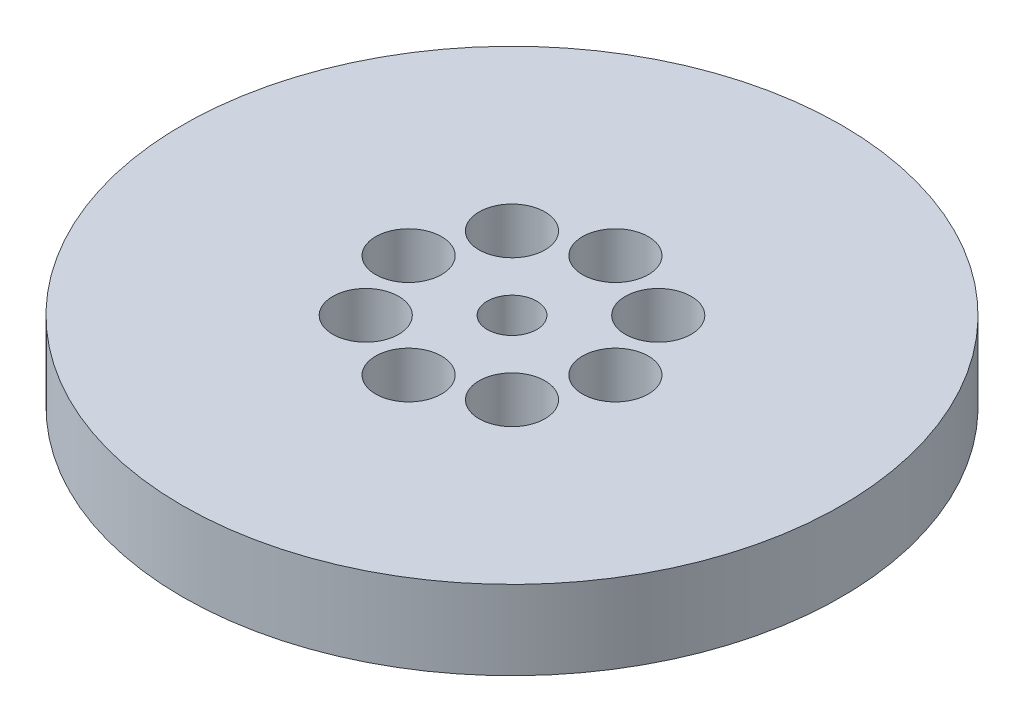
from build123d import *

# Parameters (mm, degrees)
SKETCH1_R           = 100
BOSS_EXTRUDE1_DEPTH = 24
SKETCH2_R           = 7.5
CUT_EXTRUDE1_DEPTH  = 144.443368616
SKETCH3_R           = 10
CUT_EXTRUDE2_DEPTH  = 20.903300029
CIRPATTERN1_COUNT   = 8


with BuildPart() as part:
    # Sketch1 → Boss-Extrude1 (new body)
    with BuildSketch(Plane(origin=(0, 0, 0), x_dir=(1, 0, 0), z_dir=(0, 1, 0))):
        Circle(SKETCH1_R)
    extrude(amount=BOSS_EXTRUDE1_DEPTH)

    # Sketch2 → Cut-Extrude1 (cut, through all)
    with BuildSketch(Plane(origin=(0, 0, 0), x_dir=(1, 0, 0), z_dir=(0, 1, 0))):
        Circle(SKETCH2_R)
    extrude(amount=CUT_EXTRUDE1_DEPTH, mode=Mode.SUBTRACT)

    # Sketch3 → Cut-Extrude2 (cut)
    with BuildSketch(Plane(origin=(0, 24, 0), x_dir=(1, 0, 0), z_dir=(0, 1, 0))):
        with Locations((-31.377961113, 0)):
            Circle(SKETCH3_R)
    cut_extrude2 = extrude(amount=-CUT_EXTRUDE2_DEPTH, mode=Mode.SUBTRACT)

    # CirPattern1: Cut-Extrude2 ×8 about axis
    cirpattern1_axis = Axis((0, 0, 0), (0, 1, 0))
    for i in range(1, CIRPATTERN1_COUNT):
        add(cut_extrude2.rotate(cirpattern1_axis, i * 360 / CIRPATTERN1_COUNT), mode=Mode.SUBTRACT)


solid = part.part
